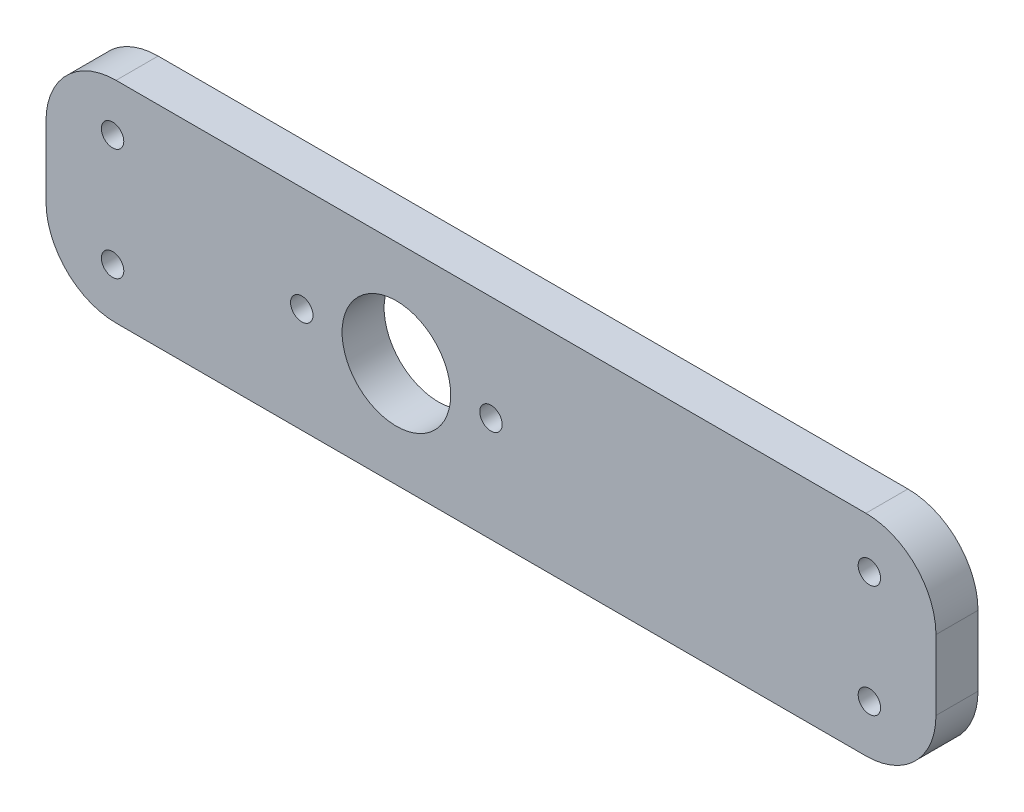
from build123d import *

# Parameters (mm, degrees)
ESBO_O1_W                = 127
ESBO_O1_H                = 30
ESBO_O1_R                = 7.75
ESBO_O1_R_2              = 1.6
RESSALTO_EXTRUS_O1_DEPTH = 6
FILETE1_R                = 10


with BuildPart() as part:
    # Esboço1 → Ressalto-extrusão1 (new body)
    with BuildSketch(Plane.XY):
        Rectangle(ESBO_O1_W, ESBO_O1_H)
        with Locations((-13.5, 0)):
            Circle(ESBO_O1_R, mode=Mode.SUBTRACT)
        Circle(ESBO_O1_R_2, mode=Mode.SUBTRACT)
        with Locations((-27, 0)):
            Circle(ESBO_O1_R_2, mode=Mode.SUBTRACT)
        with Locations((-54, 8)):
            Circle(ESBO_O1_R_2, mode=Mode.SUBTRACT)
        with Locations((-54, -8)):
            Circle(ESBO_O1_R_2, mode=Mode.SUBTRACT)
        with Locations((54, -8)):
            Circle(ESBO_O1_R_2, mode=Mode.SUBTRACT)
        with Locations((54, 8)):
            Circle(ESBO_O1_R_2, mode=Mode.SUBTRACT)
    extrude(amount=RESSALTO_EXTRUS_O1_DEPTH)

    # Filete1
    filete1_edges = [part.edges().sort_by_distance(p)[0] for p in [
        (-63.5, 15, 3),
        (-63.5, -15, 3),
        (63.5, -15, 3),
        (63.5, 15, 3),
    ]]
    fillet(filete1_edges, radius=FILETE1_R)


solid = part.part
